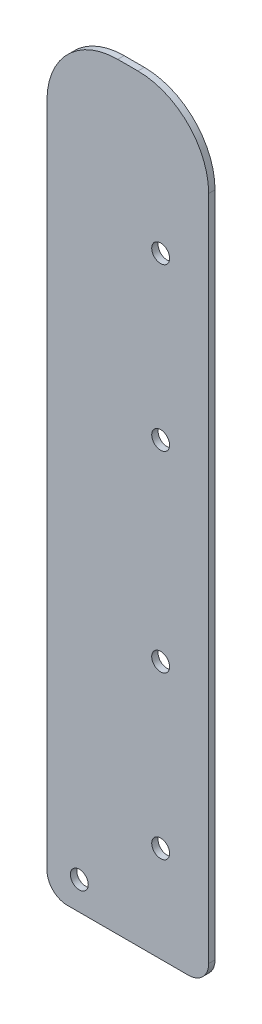
from build123d import *

# Parameters (mm, degrees)
SKETCH1_R           = 2.2479
BOSS_EXTRUDE2_DEPTH = 1.6002


with BuildPart() as part:
    # Sketch1 → Boss-Extrude2 (new body)
    with BuildSketch(Plane.XY):
        with BuildLine():
            Line((40.64, 5.08), (40.64, 172.72))
            ThreePointArc((40.64, 172.72), (35.432358569, 185.292358569), (22.86, 190.5))
            Line((22.86, 190.5), (17.78, 190.5))
            ThreePointArc((17.78, 190.5), (5.207641431, 185.292358569), (0, 172.72))
            Line((0, 172.72), (0, 5.08))
            ThreePointArc((0, 5.08), (1.487897552, 1.487897552), (5.08, 0))
            Line((5.08, 0), (28.575, 0))
            Line((28.575, 0), (35.56, 0))
            ThreePointArc((35.56, 0), (39.152102448, 1.487897552), (40.64, 5.08))
        make_face()
        with Locations((28.575, 24.13)):
            Circle(SKETCH1_R, mode=Mode.SUBTRACT)
        with Locations((28.575, 64.77)):
            Circle(SKETCH1_R, mode=Mode.SUBTRACT)
        with Locations((28.575, 113.03)):
            Circle(SKETCH1_R, mode=Mode.SUBTRACT)
        with Locations((28.575, 153.67)):
            Circle(SKETCH1_R, mode=Mode.SUBTRACT)
        with Locations((8.128, 7.112)):
            Circle(SKETCH1_R, mode=Mode.SUBTRACT)
    extrude(amount=BOSS_EXTRUDE2_DEPTH)


solid = part.part
